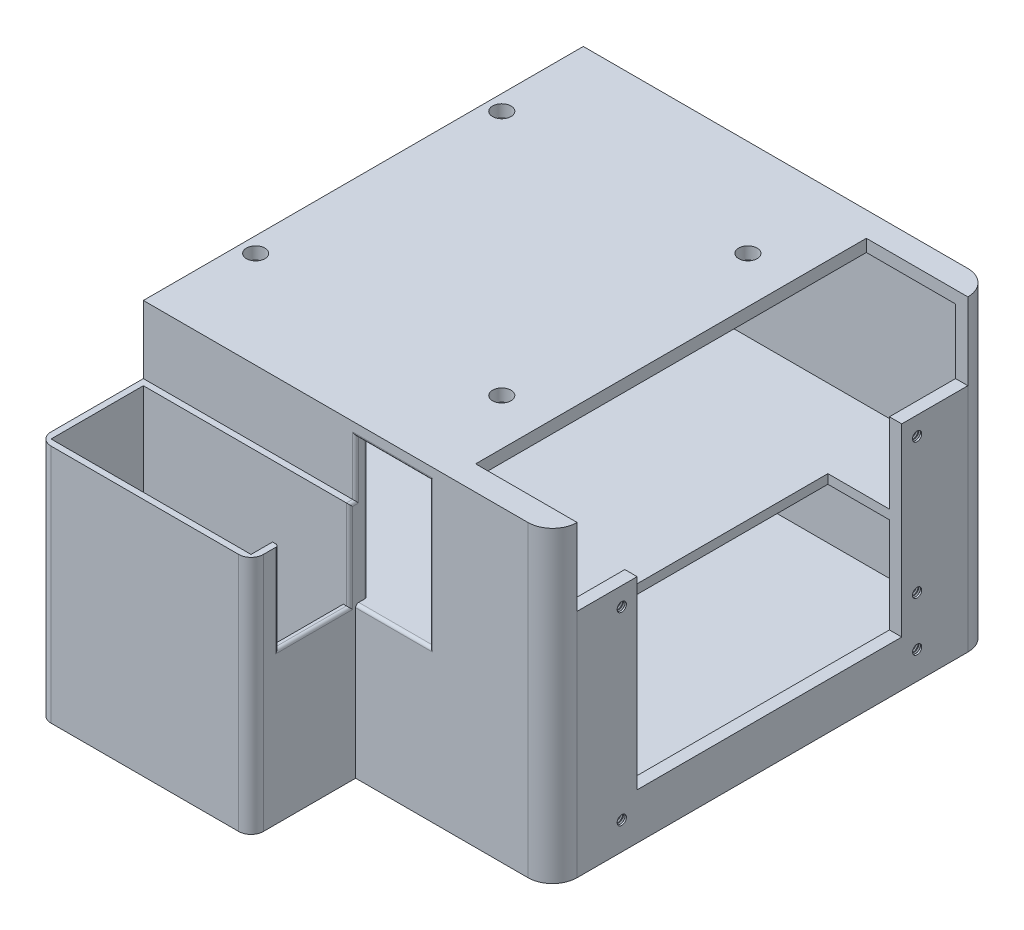
from build123d import *
from build123d.topology import SkipClean

# Parameters (mm, degrees)
SKETCH_1_W           = 133
SKETCH_1_H           = 143
EXTRUDE_1_DEPTH      = 100
SKETCH_3_W           = 135
SKETCH_3_H           = 42
CUT_EXTRUDE_1_DEPTH  = 129
FILLET_1_R           = 4
SKETCH_4_W           = 135
SKETCH_4_H           = 47
CUT_EXTRUDE_2_DEPTH  = 129
FILLET_2_R           = 8
SKETCH_5_R           = 1.5
CUT_EXTRUDE_3_DEPTH  = 220.403737434
CUT_EXTRUDE_4_DEPTH  = 4
CUT_EXTRUDE_5_REACH  = 221.404
SKETCH_7_R           = 3
EXTRUDE_2_DEPTH      = 78
SKETCH_9_W           = 65
SKETCH_9_H           = 30
CUT_EXTRUDE_6_DEPTH  = 76
CUT_EXTRUDE_7_REACH  = 189.643
SKETCH_10_W          = 23
SKETCH_10_H          = 29
CUT_EXTRUDE_8_REACH  = 221.404
SKETCH_11_W          = 24
SKETCH_11_H          = 47
FILLET_3_R           = 4
FILLET_4_R           = 1
SKETCH_12_W          = 127
SKETCH_12_H          = 4
CUT_EXTRUDE_9_DEPTH  = 29
SKETCH_13_W          = 86
SKETCH_13_H          = 3
CUT_EXTRUDE_10_DEPTH = 20
THREAD_1_PITCH       = 0.8
THREAD_2_PITCH       = 0.8
THREAD_3_PITCH       = 0.8
THREAD_4_PITCH       = 0.8
THREAD_5_PITCH       = 0.8


with BuildPart() as part:
    # Sketch 1 → 凸台-拉伸1 (new body)
    with BuildSketch(Plane(origin=(0, 0, 0), x_dir=(1, 0, 0), z_dir=(0, 1, 0))):
        with Locations((66.5, 71.5)):
            Rectangle(SKETCH_1_W, SKETCH_1_H)
    extrude(amount=EXTRUDE_1_DEPTH)

    # Sketch 3 → 切除-拉伸1 (cut)
    with BuildSketch(Plane.ZY):
        with Locations((-71.5, 25)):
            Rectangle(SKETCH_3_W, SKETCH_3_H)
    extrude(amount=-CUT_EXTRUDE_1_DEPTH, mode=Mode.SUBTRACT)

    # 圆角1
    fillet_1_edges = [part.edges().sort_by_distance(p)[0] for p in [
        (64.5, 46, -139),
        (64.5, 46, -4),
    ]]
    fillet(fillet_1_edges, radius=FILLET_1_R)

    # Sketch 4 → 切除-拉伸2 (cut)
    with BuildSketch(Plane.ZY):
        with Locations((-71.5, 72.5)):
            Rectangle(SKETCH_4_W, SKETCH_4_H)
    extrude(amount=-CUT_EXTRUDE_2_DEPTH, mode=Mode.SUBTRACT)

    # 圆角2
    fillet_2_edges = [part.edges().sort_by_distance(p)[0] for p in [
        (133, 50, -143),
        (133, 50, 0),
    ]]
    fillet(fillet_2_edges, radius=FILLET_2_R)

    # Sketch 5 → 切除-拉伸3 (cut, through all)
    with BuildSketch(Plane(origin=(133, 0, 0), x_dir=(0, 0, -1), z_dir=(1, 0, 0))):
        with Locations((118.5, 9)):
            Circle(SKETCH_5_R)
        with Locations((118.5, 25)):
            Circle(SKETCH_5_R)
        with Locations((118.5, 69)):
            Circle(SKETCH_5_R)
        with Locations((22.5, 69)):
            Circle(SKETCH_5_R)
        with Locations((22.5, 9)):
            Circle(SKETCH_5_R)
    extrude(amount=-CUT_EXTRUDE_3_DEPTH, mode=Mode.SUBTRACT)

    # 草图6 → 切除-拉伸4 (cut)
    with BuildSketch(Plane(origin=(133, 0, 0), x_dir=(0, 0, -1), z_dir=(1, 0, 0))):
        Polygon((8, 100), (8, 75), (27.5, 75), (27.5, 15), (113.5, 15), (113.5, 75), (135, 75), (135, 100), align=None)
    extrude(amount=-CUT_EXTRUDE_4_DEPTH, mode=Mode.SUBTRACT)

    # 草图7 → 切除-拉伸5 (cut, up to next)
    with BuildSketch(Plane(origin=(0, 100, 0), x_dir=(1, 0, 0), z_dir=(0, 1, 0)), mode=Mode.PRIVATE) as cut_extrude_5_sk1:
        with Locations(Location((5, 111.5, 0), (0, 0, 270))):
            Circle(SKETCH_7_R)
    cut_extrude_5_tool1 = extrude(cut_extrude_5_sk1.sketch, amount=-CUT_EXTRUDE_5_REACH, mode=Mode.PRIVATE) & part.part
    # 草图7 → 切除-拉伸5 (cut, up to next)
    with BuildSketch(Plane(origin=(0, 100, 0), x_dir=(1, 0, 0), z_dir=(0, 1, 0)), mode=Mode.PRIVATE) as cut_extrude_5_sk2:
        with Locations(Location((85, 111.5, 0), (0, 0, 270))):
            Circle(SKETCH_7_R)
    cut_extrude_5_tool2 = extrude(cut_extrude_5_sk2.sketch, amount=-CUT_EXTRUDE_5_REACH, mode=Mode.PRIVATE) & part.part
    # 草图7 → 切除-拉伸5 (cut, up to next)
    with BuildSketch(Plane(origin=(0, 100, 0), x_dir=(1, 0, 0), z_dir=(0, 1, 0)), mode=Mode.PRIVATE) as cut_extrude_5_sk3:
        with Locations(Location((85, 31.5, 0), (0, 0, 270))):
            Circle(SKETCH_7_R)
    cut_extrude_5_tool3 = extrude(cut_extrude_5_sk3.sketch, amount=-CUT_EXTRUDE_5_REACH, mode=Mode.PRIVATE) & part.part
    # 草图7 → 切除-拉伸5 (cut, up to next)
    with BuildSketch(Plane(origin=(0, 100, 0), x_dir=(1, 0, 0), z_dir=(0, 1, 0)), mode=Mode.PRIVATE) as cut_extrude_5_sk4:
        with Locations(Location((5, 31.5, 0), (0, 0, 270))):
            Circle(SKETCH_7_R)
    cut_extrude_5_tool4 = extrude(cut_extrude_5_sk4.sketch, amount=-CUT_EXTRUDE_5_REACH, mode=Mode.PRIVATE) & part.part
    add(cut_extrude_5_tool1.solids().sort_by_distance((5, 100, -111.5))[0], mode=Mode.SUBTRACT)
    add(cut_extrude_5_tool2.solids().sort_by_distance((85, 100, -111.5))[0], mode=Mode.SUBTRACT)
    add(cut_extrude_5_tool3.solids().sort_by_distance((85, 100, -31.5))[0], mode=Mode.SUBTRACT)
    add(cut_extrude_5_tool4.solids().sort_by_distance((5, 100, -31.5))[0], mode=Mode.SUBTRACT)

    # 草图8 → 凸台-拉伸2 (add)
    with BuildSketch(Plane.XZ):
        Polygon((0, 0), (69, 0), (69, 4), (69, 34), (0, 34), (0, 2), align=None)
    extrude(amount=-EXTRUDE_2_DEPTH)

    # 草图9 → 切除-拉伸6 (cut)
    with BuildSketch(Plane(origin=(0, 78, 0), x_dir=(1, 0, 0), z_dir=(0, 1, 0))):
        with Locations((34.497535067, -17)):
            Rectangle(SKETCH_9_W, SKETCH_9_H)
    extrude(amount=-CUT_EXTRUDE_6_DEPTH, mode=Mode.SUBTRACT)

    # 草图10 → 切除-拉伸7 (cut, up to next)
    with BuildSketch(Plane(origin=(69, 0, 0), x_dir=(0, 0, -1), z_dir=(1, 0, 0)), mode=Mode.PRIVATE) as cut_extrude_7_sk1:
        with Locations((-13.5, 63.5)):
            Rectangle(SKETCH_10_W, SKETCH_10_H)
    cut_extrude_7_tool1 = extrude(cut_extrude_7_sk1.sketch, amount=-CUT_EXTRUDE_7_REACH, mode=Mode.PRIVATE) & part.part
    add(cut_extrude_7_tool1.solids().sort_by_distance((69, 63.5, 13.5))[0], mode=Mode.SUBTRACT)

    # 草图11 → 切除-拉伸8 (cut, up to next)
    with BuildSketch(Plane.XY, mode=Mode.PRIVATE) as cut_extrude_8_sk1:
        with Locations((81, 72.5)):
            Rectangle(SKETCH_11_W, SKETCH_11_H)
    cut_extrude_8_tool1 = extrude(cut_extrude_8_sk1.sketch, amount=-CUT_EXTRUDE_8_REACH, mode=Mode.PRIVATE) & part.part
    add(cut_extrude_8_tool1.solids().sort_by_distance((81, 72.5, 0))[0], mode=Mode.SUBTRACT)

    # 圆角3
    fillet_3_edges = [part.edges().sort_by_distance(p)[0] for p in [
        (0, 39, 34),
        (69, 39, 34),
    ]]
    fillet(fillet_3_edges, radius=FILLET_3_R)

    # 圆角4
    fillet_4_edges = [part.edges().sort_by_distance(p)[0] for p in [
        (69, 63.5, 25),
        (69, 72.5, -4),
        (69, 49, 13.5),
        (69, 63.5, 2),
        (69, 87, 0),
        (69, 78, 1),
        (81, 96, 0),
        (93, 72.5, 0),
        (81, 49, 0),
        (93, 72.5, -4),
    ]]
    fillet(fillet_4_edges, radius=FILLET_4_R)

    # 草图12 → 切除-拉伸9 (cut)
    with BuildSketch(Plane(origin=(129, 0, 0), x_dir=(0, 0, -1), z_dir=(1, 0, 0))):
        with Locations((71.5, 98)):
            Rectangle(SKETCH_12_W, SKETCH_12_H)
    extrude(amount=-CUT_EXTRUDE_9_DEPTH, mode=Mode.SUBTRACT)

    # 草图13 → 切除-拉伸10 (cut)
    with BuildSketch(Plane(origin=(129, 0, 0), x_dir=(0, 0, -1), z_dir=(1, 0, 0))):
        with Locations((70.5, 47.5)):
            Rectangle(SKETCH_13_W, SKETCH_13_H)
    extrude(amount=-CUT_EXTRUDE_10_DEPTH, mode=Mode.SUBTRACT)

    # 螺纹线1: the profile of Sketch 1 2 profile screwed along a right-hand helix of 5 turns, 8 arcs to a turn; built about Z, then put on its axis
    with SkipClean():  # the faces are left unmerged after this step: merging them gives an invalid solid
        thread_1_z = Axis((0, 0, 0), (0, 0, 1))
        thread_1_corners = [(1.4997, 0, -0.000173205), (1.9330127, 0, 0.249999999), (1.9330127, 0, 0.349999999), (1.4997, 0, 0.600173203)]
        with BuildLine(mode=Mode.PRIVATE) as thread_1_profile:
            Line(thread_1_corners[0], thread_1_corners[1])
            Line(thread_1_corners[1], thread_1_corners[2])
            Line(thread_1_corners[2], thread_1_corners[3])
            Line(thread_1_corners[3], thread_1_corners[0])
        thread_1_cap = Face(thread_1_profile.wire())
        thread_1_turn_angles = [0, 22.5, 45, 67.5, 90, 112.5, 135, 157.5, 180, 202.5, 225, 247.5, 270, 292.5, 315, 337.5, 360]
        thread_1_turn_weights = [1, 0.9238795325112867, 1, 0.9238795325112867, 1, 0.9238795325112867, 1, 0.9238795325112867, 1, 0.9238795325112867, 1, 0.9238795325112867, 1, 0.9238795325112867, 1, 0.9238795325112867, 1]
        thread_1_turn_rails = [Edge.make_bspline([Vector(p[0], p[1], 0).rotate(thread_1_z, thread_1_turn_angles[k]) / thread_1_turn_weights[k] + Vector(0, 0, p[2] + THREAD_1_PITCH * thread_1_turn_angles[k] / 360) for k in range(17)], [0, 0, 0, 1, 1, 2, 2, 3, 3, 4, 4, 5, 5, 6, 6, 7, 7, 8, 8, 8], 2, thread_1_turn_weights) for p in thread_1_corners]
        thread_1_turn_sides = [Face.make_surface_from_curves(thread_1_turn_rails[p[0]], thread_1_turn_rails[p[1]]) for p in [(0, 1), (1, 2), (2, 3), (3, 0)]]
        thread_1 = Plane(origin=(133, 9, -118.5), x_dir=(0, 0, 1), z_dir=(-1, 0, 0)) * Solid(Shell([*[p.moved(Location((0, 0, THREAD_1_PITCH * i))) for i in range(5) for p in thread_1_turn_sides], thread_1_cap, thread_1_cap.rotate(thread_1_z, 1800).moved(Location((0, 0, THREAD_1_PITCH * 1800 / 360)))]))
        add(thread_1, mode=Mode.SUBTRACT)

    # 螺纹线2: the profile of 螺纹线轮廓2 profile screwed along a right-hand helix of 5 turns, 8 arcs to a turn; built about Z, then put on its axis
    with SkipClean():  # the faces are left unmerged after this step: merging them gives an invalid solid
        thread_2_z = Axis((0, 0, 0), (0, 0, 1))
        thread_2_corners = [(1.4997, 0, -0.000173205), (1.9330127, 0, 0.249999999), (1.9330127, 0, 0.349999999), (1.4997, 0, 0.600173203)]
        with BuildLine(mode=Mode.PRIVATE) as thread_2_profile:
            Line(thread_2_corners[0], thread_2_corners[1])
            Line(thread_2_corners[1], thread_2_corners[2])
            Line(thread_2_corners[2], thread_2_corners[3])
            Line(thread_2_corners[3], thread_2_corners[0])
        thread_2_cap = Face(thread_2_profile.wire())
        thread_2_turn_angles = [0, 22.5, 45, 67.5, 90, 112.5, 135, 157.5, 180, 202.5, 225, 247.5, 270, 292.5, 315, 337.5, 360]
        thread_2_turn_weights = [1, 0.9238795325112867, 1, 0.9238795325112867, 1, 0.9238795325112867, 1, 0.9238795325112867, 1, 0.9238795325112867, 1, 0.9238795325112867, 1, 0.9238795325112867, 1, 0.9238795325112867, 1]
        thread_2_turn_rails = [Edge.make_bspline([Vector(p[0], p[1], 0).rotate(thread_2_z, thread_2_turn_angles[k]) / thread_2_turn_weights[k] + Vector(0, 0, p[2] + THREAD_2_PITCH * thread_2_turn_angles[k] / 360) for k in range(17)], [0, 0, 0, 1, 1, 2, 2, 3, 3, 4, 4, 5, 5, 6, 6, 7, 7, 8, 8, 8], 2, thread_2_turn_weights) for p in thread_2_corners]
        thread_2_turn_sides = [Face.make_surface_from_curves(thread_2_turn_rails[p[0]], thread_2_turn_rails[p[1]]) for p in [(0, 1), (1, 2), (2, 3), (3, 0)]]
        thread_2 = Plane(origin=(133, 25, -118.5), x_dir=(0, 0, 1), z_dir=(-1, 0, 0)) * Solid(Shell([*[p.moved(Location((0, 0, THREAD_2_PITCH * i))) for i in range(5) for p in thread_2_turn_sides], thread_2_cap, thread_2_cap.rotate(thread_2_z, 1800).moved(Location((0, 0, THREAD_2_PITCH * 1800 / 360)))]))
        add(thread_2, mode=Mode.SUBTRACT)

    # 螺纹线3: the profile of Sketch 3 2 profile screwed along a right-hand helix of 5 turns, 8 arcs to a turn; built about Z, then put on its axis
    with SkipClean():  # the faces are left unmerged after this step: merging them gives an invalid solid
        thread_3_z = Axis((0, 0, 0), (0, 0, 1))
        thread_3_corners = [(1.4997, 0, -0.000173205), (1.9330127, 0, 0.249999999), (1.9330127, 0, 0.349999999), (1.4997, 0, 0.600173203)]
        with BuildLine(mode=Mode.PRIVATE) as thread_3_profile:
            Line(thread_3_corners[0], thread_3_corners[1])
            Line(thread_3_corners[1], thread_3_corners[2])
            Line(thread_3_corners[2], thread_3_corners[3])
            Line(thread_3_corners[3], thread_3_corners[0])
        thread_3_cap = Face(thread_3_profile.wire())
        thread_3_turn_angles = [0, 22.5, 45, 67.5, 90, 112.5, 135, 157.5, 180, 202.5, 225, 247.5, 270, 292.5, 315, 337.5, 360]
        thread_3_turn_weights = [1, 0.9238795325112867, 1, 0.9238795325112867, 1, 0.9238795325112867, 1, 0.9238795325112867, 1, 0.9238795325112867, 1, 0.9238795325112867, 1, 0.9238795325112867, 1, 0.9238795325112867, 1]
        thread_3_turn_rails = [Edge.make_bspline([Vector(p[0], p[1], 0).rotate(thread_3_z, thread_3_turn_angles[k]) / thread_3_turn_weights[k] + Vector(0, 0, p[2] + THREAD_3_PITCH * thread_3_turn_angles[k] / 360) for k in range(17)], [0, 0, 0, 1, 1, 2, 2, 3, 3, 4, 4, 5, 5, 6, 6, 7, 7, 8, 8, 8], 2, thread_3_turn_weights) for p in thread_3_corners]
        thread_3_turn_sides = [Face.make_surface_from_curves(thread_3_turn_rails[p[0]], thread_3_turn_rails[p[1]]) for p in [(0, 1), (1, 2), (2, 3), (3, 0)]]
        thread_3 = Plane(origin=(133, 69, -118.5), x_dir=(0, 0, 1), z_dir=(-1, 0, 0)) * Solid(Shell([*[p.moved(Location((0, 0, THREAD_3_PITCH * i))) for i in range(5) for p in thread_3_turn_sides], thread_3_cap, thread_3_cap.rotate(thread_3_z, 1800).moved(Location((0, 0, THREAD_3_PITCH * 1800 / 360)))]))
        add(thread_3, mode=Mode.SUBTRACT)

    # 螺纹线4: the profile of Sketch 4 2 profile screwed along a right-hand helix of 5 turns, 8 arcs to a turn; built about Z, then put on its axis
    with SkipClean():  # the faces are left unmerged after this step: merging them gives an invalid solid
        thread_4_z = Axis((0, 0, 0), (0, 0, 1))
        thread_4_corners = [(1.4997, 0, -0.000173205), (1.9330127, 0, 0.249999999), (1.9330127, 0, 0.349999999), (1.4997, 0, 0.600173203)]
        with BuildLine(mode=Mode.PRIVATE) as thread_4_profile:
            Line(thread_4_corners[0], thread_4_corners[1])
            Line(thread_4_corners[1], thread_4_corners[2])
            Line(thread_4_corners[2], thread_4_corners[3])
            Line(thread_4_corners[3], thread_4_corners[0])
        thread_4_cap = Face(thread_4_profile.wire())
        thread_4_turn_angles = [0, 22.5, 45, 67.5, 90, 112.5, 135, 157.5, 180, 202.5, 225, 247.5, 270, 292.5, 315, 337.5, 360]
        thread_4_turn_weights = [1, 0.9238795325112867, 1, 0.9238795325112867, 1, 0.9238795325112867, 1, 0.9238795325112867, 1, 0.9238795325112867, 1, 0.9238795325112867, 1, 0.9238795325112867, 1, 0.9238795325112867, 1]
        thread_4_turn_rails = [Edge.make_bspline([Vector(p[0], p[1], 0).rotate(thread_4_z, thread_4_turn_angles[k]) / thread_4_turn_weights[k] + Vector(0, 0, p[2] + THREAD_4_PITCH * thread_4_turn_angles[k] / 360) for k in range(17)], [0, 0, 0, 1, 1, 2, 2, 3, 3, 4, 4, 5, 5, 6, 6, 7, 7, 8, 8, 8], 2, thread_4_turn_weights) for p in thread_4_corners]
        thread_4_turn_sides = [Face.make_surface_from_curves(thread_4_turn_rails[p[0]], thread_4_turn_rails[p[1]]) for p in [(0, 1), (1, 2), (2, 3), (3, 0)]]
        thread_4 = Plane(origin=(133, 69, -22.5), x_dir=(0, 0, 1), z_dir=(-1, 0, 0)) * Solid(Shell([*[p.moved(Location((0, 0, THREAD_4_PITCH * i))) for i in range(5) for p in thread_4_turn_sides], thread_4_cap, thread_4_cap.rotate(thread_4_z, 1800).moved(Location((0, 0, THREAD_4_PITCH * 1800 / 360)))]))
        add(thread_4, mode=Mode.SUBTRACT)

    # 螺纹线5: the profile of Sketch 5 2 profile screwed along a right-hand helix of 5 turns, 8 arcs to a turn; built about Z, then put on its axis
    with SkipClean():  # the faces are left unmerged after this step: merging them gives an invalid solid
        thread_5_z = Axis((0, 0, 0), (0, 0, 1))
        thread_5_corners = [(1.4997, 0, -0.000173205), (1.9330127, 0, 0.249999999), (1.9330127, 0, 0.349999999), (1.4997, 0, 0.600173203)]
        with BuildLine(mode=Mode.PRIVATE) as thread_5_profile:
            Line(thread_5_corners[0], thread_5_corners[1])
            Line(thread_5_corners[1], thread_5_corners[2])
            Line(thread_5_corners[2], thread_5_corners[3])
            Line(thread_5_corners[3], thread_5_corners[0])
        thread_5_cap = Face(thread_5_profile.wire())
        thread_5_turn_angles = [0, 22.5, 45, 67.5, 90, 112.5, 135, 157.5, 180, 202.5, 225, 247.5, 270, 292.5, 315, 337.5, 360]
        thread_5_turn_weights = [1, 0.9238795325112867, 1, 0.9238795325112867, 1, 0.9238795325112867, 1, 0.9238795325112867, 1, 0.9238795325112867, 1, 0.9238795325112867, 1, 0.9238795325112867, 1, 0.9238795325112867, 1]
        thread_5_turn_rails = [Edge.make_bspline([Vector(p[0], p[1], 0).rotate(thread_5_z, thread_5_turn_angles[k]) / thread_5_turn_weights[k] + Vector(0, 0, p[2] + THREAD_5_PITCH * thread_5_turn_angles[k] / 360) for k in range(17)], [0, 0, 0, 1, 1, 2, 2, 3, 3, 4, 4, 5, 5, 6, 6, 7, 7, 8, 8, 8], 2, thread_5_turn_weights) for p in thread_5_corners]
        thread_5_turn_sides = [Face.make_surface_from_curves(thread_5_turn_rails[p[0]], thread_5_turn_rails[p[1]]) for p in [(0, 1), (1, 2), (2, 3), (3, 0)]]
        thread_5 = Plane(origin=(133, 9, -22.5), x_dir=(0, 0, 1), z_dir=(-1, 0, 0)) * Solid(Shell([*[p.moved(Location((0, 0, THREAD_5_PITCH * i))) for i in range(5) for p in thread_5_turn_sides], thread_5_cap, thread_5_cap.rotate(thread_5_z, 1800).moved(Location((0, 0, THREAD_5_PITCH * 1800 / 360)))]))
        add(thread_5, mode=Mode.SUBTRACT)


solid = part.part
